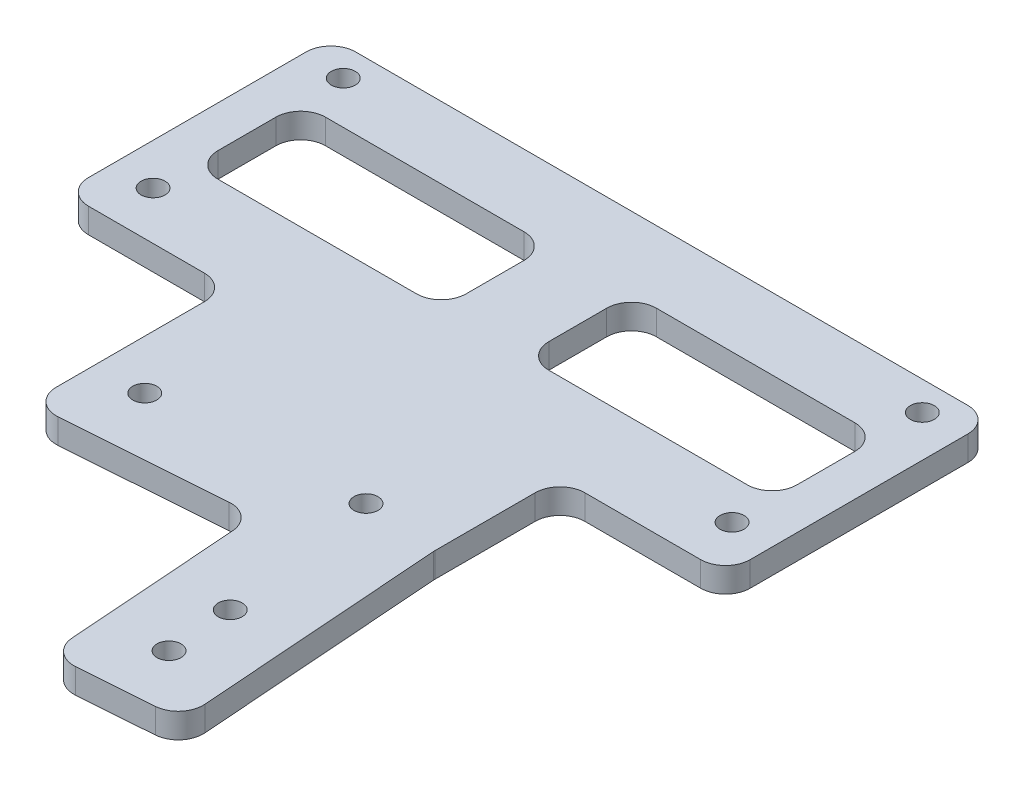
from build123d import *

# Parameters (mm, degrees)
SKETCH_1_R          = 1.45
SKETCH_1_W          = 30
SKETCH_1_H          = 13
EXTRUDE_1_DEPTH     = 3
SKETCH_2_W          = 80
SKETCH_2_H          = 2
CUT_EXTRUDE_1_DEPTH = 59.005258382
FILLET_1_R          = 3


with BuildPart() as part:
    # 草图1 → 凸台-拉伸1 (new body)
    with BuildSketch(Plane(origin=(0, 0, 0), x_dir=(1, 0, 0), z_dir=(0, 1, 0))):
        Polygon((-20, -7.6), (-20, 7.6), (-40, 7.6), (-40, 41.9), (40, 41.9), (40, 7.6), (20, 7.6), (20, -7.6), (20.435801373, -13.585557258), (22.396449617, -40.514275357), (7.436050673, -41.603524381), (5.475402429, -14.674806282), (-20, -16.529640324), align=None)
        with Locations(Location((-35, 13.4, 0), (0, 0, 270))):
            Circle(SKETCH_1_R, mode=Mode.SUBTRACT)
        with Locations(Location((-35, 36.4, 0), (0, 0, 270))):
            Circle(SKETCH_1_R, mode=Mode.SUBTRACT)
        with Locations(Location((35, 13.4, 0), (0, 0, 90))):
            Circle(SKETCH_1_R, mode=Mode.SUBTRACT)
        with Locations(Location((35, 36.4, 0), (0, 0, 90))):
            Circle(SKETCH_1_R, mode=Mode.SUBTRACT)
        with Locations(Location((-14.029429392, -8.57507717, 0), (0, 0, 270))):
            Circle(SKETCH_1_R, mode=Mode.SUBTRACT)
        with Locations(Location((10.904568848, -6.759662129, 0), (0, 0, 270))):
            Circle(SKETCH_1_R, mode=Mode.SUBTRACT)
        with Locations(Location((13.827001121, -26.098500925, 0), (0, 0, 270))):
            Circle(SKETCH_1_R, mode=Mode.SUBTRACT)
        with Locations(Location((14.407933934, -34.077380362, 0), (0, 0, 270))):
            Circle(SKETCH_1_R, mode=Mode.SUBTRACT)
        with Locations((-20, 24.75)):
            Rectangle(SKETCH_1_W, SKETCH_1_H, mode=Mode.SUBTRACT)
        with Locations((20, 24.75)):
            Rectangle(SKETCH_1_W, SKETCH_1_H, mode=Mode.SUBTRACT)
    extrude(amount=EXTRUDE_1_DEPTH)

    # 草图2 → 切除-拉伸1 (cut, through all)
    with BuildSketch(Plane(origin=(0, 3, 0), x_dir=(1, 0, 0), z_dir=(0, 1, 0))):
        with Locations((0, 40.9)):
            Rectangle(SKETCH_2_W, SKETCH_2_H)
    extrude(amount=-CUT_EXTRUDE_1_DEPTH, mode=Mode.SUBTRACT)

    # 圆角1
    # the kernel refuses this fillet: 3 mm, written as the material it adds along each edge
    with BuildSketch(Plane(origin=(20, 0, -7.6), x_dir=(0, 0, 1), z_dir=(0, 1, 0)), Plane(origin=(5.475402429, 0, 14.674806282), x_dir=(-0.9973599295981227, 0, 0.07261660162819321), z_dir=(0, 1, 0)), Plane(origin=(-35, 0, -31.25), x_dir=(0, 0, 1), z_dir=(0, 1, 0)), Plane(origin=(-35, 0, -18.25), x_dir=(1, 0, 0), z_dir=(0, 1, 0)), Plane(origin=(5, 0, -18.25), x_dir=(1, 0, 0), z_dir=(0, 1, 0)), Plane(origin=(5, 0, -31.25), x_dir=(0, 0, 1), z_dir=(0, 1, 0))) as fillet_1_piece_1:
        with BuildLine():
            CenterArc((FILLET_1_R, FILLET_1_R), FILLET_1_R, 180, 90)
            Line((0, FILLET_1_R), (0, 0))
            Line((0, 0), (FILLET_1_R, 0))
        make_face()
    extrude(amount=3)
    with BuildSketch(Plane(origin=(20, 0, 7.6), x_dir=(0.07261660162820198, 0, 0.9973599295981221), z_dir=(0, 1, 0))) as fillet_1_piece_2:
        with BuildLine():
            CenterArc((FILLET_1_R * 0.0363562923998, FILLET_1_R), FILLET_1_R, 265.835709886, 4.164290114)
            Line((-FILLET_1_R * 0.0362603092284, FILLET_1_R * 0.00264007040188), (0, 0))
            Line((0, 0), (FILLET_1_R * 0.0363562923998, 0))
        make_face()
    extrude(amount=3)
    with BuildSketch(Plane(origin=(-20, 0, -7.6), x_dir=(0, 0, 1), z_dir=(0, 1, 0)), Plane(origin=(-5, 0, -18.25), x_dir=(-1, 0, 0), z_dir=(0, 1, 0)), Plane(origin=(-5, 0, -31.25), x_dir=(0, 0, 1), z_dir=(0, 1, 0)), Plane(origin=(35, 0, -18.25), x_dir=(-1, 0, 0), z_dir=(0, 1, 0)), Plane(origin=(35, 0, -31.25), x_dir=(0, 0, 1), z_dir=(0, 1, 0))) as fillet_1_piece_3:
        with BuildLine():
            CenterArc((FILLET_1_R, -FILLET_1_R), FILLET_1_R, 90, 90)
            Line((0, -FILLET_1_R), (0, 0))
            Line((0, 0), (FILLET_1_R, 0))
        make_face()
    extrude(amount=3)
    # the kernel refuses this fillet: 3 mm, written as the material it takes off along each edge
    with BuildSketch(Plane(origin=(-40, 10.5, -39.9), x_dir=(1, 0, 0), z_dir=(0, -1, 0)), Plane(origin=(40, 10.5, -39.9), x_dir=(0, 0, 1), z_dir=(0, -1, 0)), Plane(origin=(-40, -7.5, -7.6), x_dir=(1, 0, 0), z_dir=(0, 1, 0))) as fillet_1_2_piece_1:
        with BuildLine():
            CenterArc((FILLET_1_R, FILLET_1_R), FILLET_1_R, 180, 90)
            Line((0, FILLET_1_R), (0, 0))
            Line((0, 0), (FILLET_1_R, 0))
        make_face()
    extrude(amount=18, mode=Mode.SUBTRACT)
    with BuildSketch(Plane(origin=(22.396449617, -7.5, 40.514275357), x_dir=(-0.9973599295981227, 0, 0.07261660162819322), z_dir=(0, 1, 0)), Plane(origin=(7.436050673, -7.5, 41.603524381), x_dir=(-0.07261660162819356, 0, -0.9973599295981227), z_dir=(0, 1, 0)), Plane(origin=(40, -7.5, -7.6), x_dir=(-1, 0, 0), z_dir=(0, 1, 0))) as fillet_1_2_piece_2:
        with BuildLine():
            CenterArc((FILLET_1_R, -FILLET_1_R), FILLET_1_R, 90, 90)
            Line((0, -FILLET_1_R), (0, 0))
            Line((0, 0), (FILLET_1_R, 0))
        make_face()
    extrude(amount=18, mode=Mode.SUBTRACT)
    with BuildSketch(Plane(origin=(-20, -8.065919107, 16.529640324), x_dir=(0, 0, -1), z_dir=(0, 1, 0))) as fillet_1_2_piece_3:
        with BuildLine():
            CenterArc((FILLET_1_R * 1.07545588087, -FILLET_1_R), FILLET_1_R, 90, 94.164290114)
            Line((FILLET_1_R * 0.0780959512697, -FILLET_1_R * 1.07261660163), (0, 0))
            Line((0, 0), (FILLET_1_R * 1.07545588087, 0))
        make_face()
    extrude(amount=19.131838213, mode=Mode.SUBTRACT)


solid = part.part
